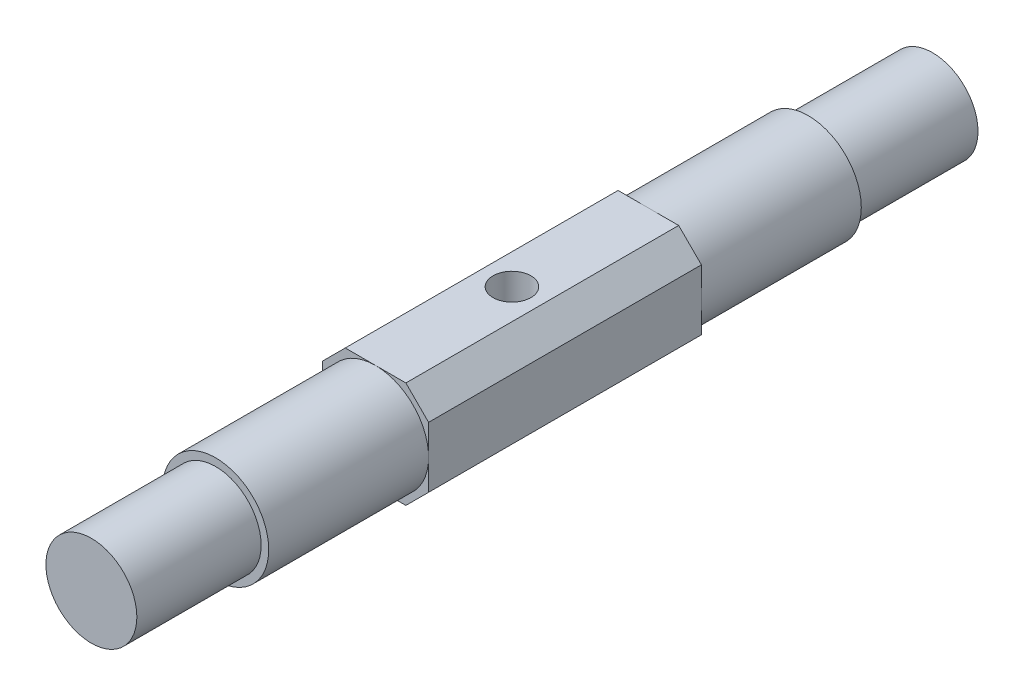
from build123d import *

# Parameters (mm, degrees)
CROQUIS1_R              = 3
SALIENTE_EXTRUIR1_DEPTH = 8.2
CROQUIS2_R              = 3.5
SALIENTE_EXTRUIR2_DEPTH = 10.55
CROQUIS3_W              = 7
CROQUIS3_H              = 7
SALIENTE_EXTRUIR3_DEPTH = 18
CROQUIS4_R              = 3.5
SALIENTE_EXTRUIR4_DEPTH = 10.55
CROQUIS5_R              = 3
SALIENTE_EXTRUIR5_DEPTH = 8.2
CROQUIS6_R              = 1.25
CORTAR_EXTRUIR1_DEPTH   = 57.04908563
CHAFL_N1_SIZE           = 1.5


with BuildPart() as part:
    # Croquis1 → Saliente-Extruir1 (new body)
    with BuildSketch(Plane.XY):
        Circle(CROQUIS1_R)
    extrude(amount=SALIENTE_EXTRUIR1_DEPTH)

    # Croquis2 → Saliente-Extruir2 (add)
    with BuildSketch(Plane.XY.offset(8.2)):
        Circle(CROQUIS2_R)
    extrude(amount=SALIENTE_EXTRUIR2_DEPTH)

    # Croquis3 → Saliente-Extruir3 (add)
    with BuildSketch(Plane.XY.offset(18.75)):
        Rectangle(CROQUIS3_W, CROQUIS3_H)
    extrude(amount=SALIENTE_EXTRUIR3_DEPTH)

    # Croquis4 → Saliente-Extruir4 (add)
    with BuildSketch(Plane.XY.offset(36.75)):
        Circle(CROQUIS4_R)
    extrude(amount=SALIENTE_EXTRUIR4_DEPTH)

    # Croquis5 → Saliente-Extruir5 (add)
    with BuildSketch(Plane.XY.offset(47.3)):
        Circle(CROQUIS5_R)
    extrude(amount=SALIENTE_EXTRUIR5_DEPTH)

    # Croquis6 → Cortar-Extruir1 (cut, through all)
    with BuildSketch(Plane(origin=(0, 3.5, 0), x_dir=(1, 0, 0), z_dir=(0, 1, 0))):
        with Locations((0, -27.75)):
            Circle(CROQUIS6_R)
    extrude(amount=-CORTAR_EXTRUIR1_DEPTH, mode=Mode.SUBTRACT)

    # Chaflán1
    chafl_n1_edges = [part.edges().sort_by_distance(p)[0] for p in [
        (3.5, -3.5, 27.75),
        (3.5, 3.5, 27.75),
        (-3.5, -3.5, 27.75),
        (-3.5, 3.5, 27.75),
    ]]
    chamfer(chafl_n1_edges, length=CHAFL_N1_SIZE)


solid = part.part
